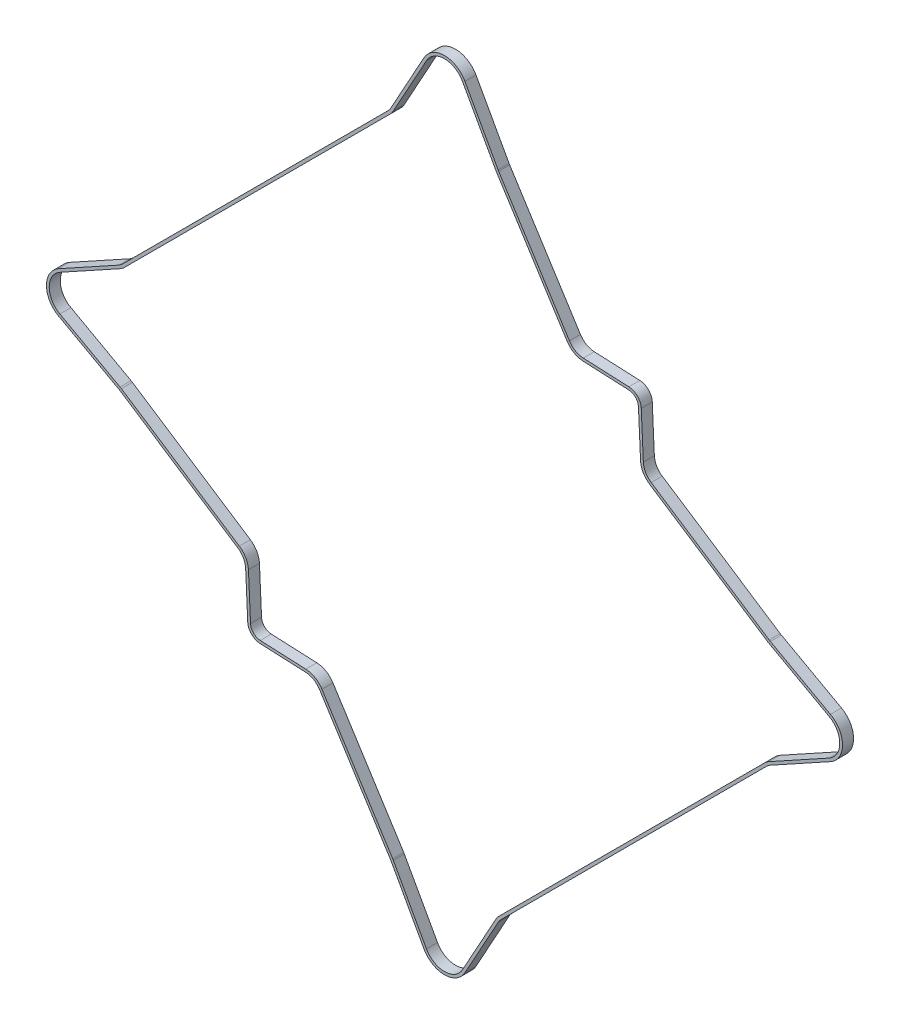
from build123d import *

# Parameters (mm, degrees)
EXTRUDE_THIN1_DEPTH = 3


with BuildPart() as part:
    # Sketch2 → Extrude-Thin1 (new, symmetric)
    with BuildSketch(Plane.XY):
        with BuildLine():
            Line((30.511015203, -65.744573977), (-8.003267358, -5.081152585))
            ThreePointArc((-8.003267358, -5.081152585), (-8.156222495, -4.831814836), (-8.301412185, -4.577876771))
            Line((-8.301412185, -4.577876771), (-26.349049271, 28.149276433))
            ThreePointArc((-26.349049271, 28.149276433), (-37.5, 34.7341), (-48.650950729, 28.149276433))
            Line((-48.650950729, 28.149276433), (-66.698587815, -4.577876771))
            ThreePointArc((-66.698587815, -4.577876771), (-67.422710112, -5.696935838), (-68.296627714, -6.703372286))
            Line((-68.296627714, -6.703372286), (-212.796627714, -151.203372286))
            ThreePointArc((-212.796627714, -151.203372286), (-213.803064162, -152.077289888), (-214.922123229, -152.801412185))
            Line((-214.922123229, -152.801412185), (-247.649276433, -170.849049271))
            ThreePointArc((-247.649276433, -170.849049271), (-254.2341, -182), (-247.649276433, -193.150950729))
            Line((-247.649276433, -193.150950729), (-214.922123229, -211.198587815))
            ThreePointArc((-214.922123229, -211.198587815), (-214.609366132, -211.378910149), (-214.303701601, -211.571009967))
            Line((-214.303701601, -211.571009967), (-150.037284252, -253.688288486))
            ThreePointArc((-150.037284252, -253.688288486), (-146.997960144, -256.922076508), (-145.763452351, -261.184806444))
            Line((-145.763452351, -261.184806444), (-144.631039477, -285.982008601))
            ThreePointArc((-144.631039477, -285.982008601), (-142.563996899, -290.666992857), (-137.879012644, -292.734035435))
            Line((-137.879012644, -292.734035435), (-113.081810486, -293.866448308))
            ThreePointArc((-113.081810486, -293.866448308), (-108.759684125, -295.135103515), (-105.511015203, -298.255426023))
            Line((-105.511015203, -298.255426023), (-66.996732642, -358.918847415))
            ThreePointArc((-66.996732642, -358.918847415), (-66.843777505, -359.168185164), (-66.698587814, -359.422123229))
            Line((-66.698587815, -359.422123229), (-48.650950729, -392.149276433))
            ThreePointArc((-48.650950729, -392.149276433), (-37.5, -398.7341), (-26.349049271, -392.149276433))
            Line((-26.349049271, -392.149276433), (-8.301412185, -359.422123229))
            ThreePointArc((-8.301412185, -359.422123229), (-7.577289888, -358.303064162), (-6.703372286, -357.296627714))
            Line((-6.703372286, -357.296627714), (137.796627714, -212.796627714))
            ThreePointArc((137.796627714, -212.796627714), (138.803064162, -211.922710112), (139.922123229, -211.198587815))
            Line((139.922123229, -211.198587815), (172.649276433, -193.150950729))
            ThreePointArc((172.649276433, -193.150950729), (179.2341, -182), (172.649276433, -170.849049271))
            Line((172.649276433, -170.849049271), (139.922123229, -152.801412185))
            ThreePointArc((139.922123229, -152.801412185), (139.609366132, -152.621089851), (139.303701601, -152.428990033))
            Line((139.303701601, -152.428990033), (75.037284252, -110.311711514))
            ThreePointArc((75.037284252, -110.311711514), (71.997960144, -107.077923492), (70.763452351, -102.815193556))
            Line((70.763452351, -102.815193556), (69.631039477, -78.017991399))
            ThreePointArc((69.631039477, -78.017991399), (67.563996899, -73.333007143), (62.879012644, -71.265964565))
            Line((62.879012644, -71.265964565), (38.081810486, -70.133551692))
            ThreePointArc((38.081810486, -70.133551692), (33.759684125, -68.864896485), (30.511015203, -65.744573977))
        make_face()
        with BuildLine():
            Line((29.227790901, -66.559273547), (-9.28649166, -5.895852156))
            ThreePointArc((-9.28649166, -5.895852156), (-9.46397125, -5.606536202), (-9.6324403, -5.311882329))
            Line((-9.6324403, -5.311882329), (-27.680077385, 27.415270875))
            ThreePointArc((-27.680077385, 27.415270875), (-37.5, 33.2141), (-47.319922615, 27.415270875))
            Line((-47.319922615, 27.415270875), (-65.3675597, -5.311882329))
            ThreePointArc((-65.3675597, -5.311882329), (-66.207785995, -6.610368589), (-67.221825407, -7.778174593))
            Line((-67.221825407, -7.778174593), (-211.721825407, -152.278174593))
            ThreePointArc((-211.721825407, -152.278174593), (-212.889631411, -153.292214005), (-214.188117671, -154.1324403))
            Line((-214.188117671, -154.1324403), (-246.915270875, -172.180077385))
            ThreePointArc((-246.915270875, -172.180077385), (-252.7141, -182), (-246.915270875, -191.819922615))
            Line((-246.915270875, -191.819922615), (-214.188117671, -209.8675597))
            ThreePointArc((-214.188117671, -209.8675597), (-213.825213867, -210.076794476), (-213.470539832, -210.299695109))
            Line((-213.470539832, -210.299695109), (-149.204122483, -252.416973628))
            ThreePointArc((-149.204122483, -252.416973628), (-145.677480586, -256.169259307), (-144.245034834, -261.11546493))
            Line((-144.245034834, -261.11546493), (-143.112621961, -285.912667087))
            ThreePointArc((-143.112621961, -285.912667087), (-141.489194592, -289.592190549), (-137.80967113, -291.215617918))
            Line((-137.80967113, -291.215617918), (-113.012468972, -292.348030792))
            ThreePointArc((-113.012468972, -292.348030792), (-107.997343447, -293.82009907), (-104.227790901, -297.440726453))
            Line((-104.227790901, -297.440726453), (-65.71350834, -358.104147844))
            ThreePointArc((-65.71350834, -358.104147844), (-65.53602875, -358.393463798), (-65.3675597, -358.688117671))
            Line((-65.3675597, -358.688117671), (-47.319922615, -391.415270875))
            ThreePointArc((-47.319922615, -391.415270875), (-37.5, -397.2141), (-27.680077385, -391.415270875))
            Line((-27.680077385, -391.415270875), (-9.6324403, -358.688117671))
            ThreePointArc((-9.6324403, -358.688117671), (-8.792214005, -357.389631411), (-7.778174593, -356.221825407))
            Line((-7.778174593, -356.221825407), (136.721825407, -211.721825407))
            ThreePointArc((136.721825407, -211.721825407), (137.889631411, -210.707785995), (139.188117671, -209.8675597))
            Line((139.188117671, -209.8675597), (171.915270875, -191.819922615))
            ThreePointArc((171.915270875, -191.819922615), (177.7141, -182), (171.915270875, -172.180077385))
            Line((171.915270875, -172.180077385), (139.188117671, -154.1324403))
            ThreePointArc((139.188117671, -154.1324403), (138.825213867, -153.923205524), (138.470539832, -153.700304891))
            Line((138.470539832, -153.700304891), (74.204122483, -111.583026372))
            ThreePointArc((74.204122483, -111.583026372), (70.677480586, -107.830740693), (69.245034834, -102.88453507))
            Line((69.245034834, -102.88453507), (68.112621961, -78.087332913))
            ThreePointArc((68.112621961, -78.087332913), (66.489194592, -74.407809451), (62.80967113, -72.784382082))
            Line((62.80967113, -72.784382082), (38.012468972, -71.651969208))
            ThreePointArc((38.012468972, -71.651969208), (32.997343447, -70.17990093), (29.227790901, -66.559273547))
        make_face(mode=Mode.SUBTRACT)
    extrude(amount=EXTRUDE_THIN1_DEPTH, both=True)


solid = part.part
